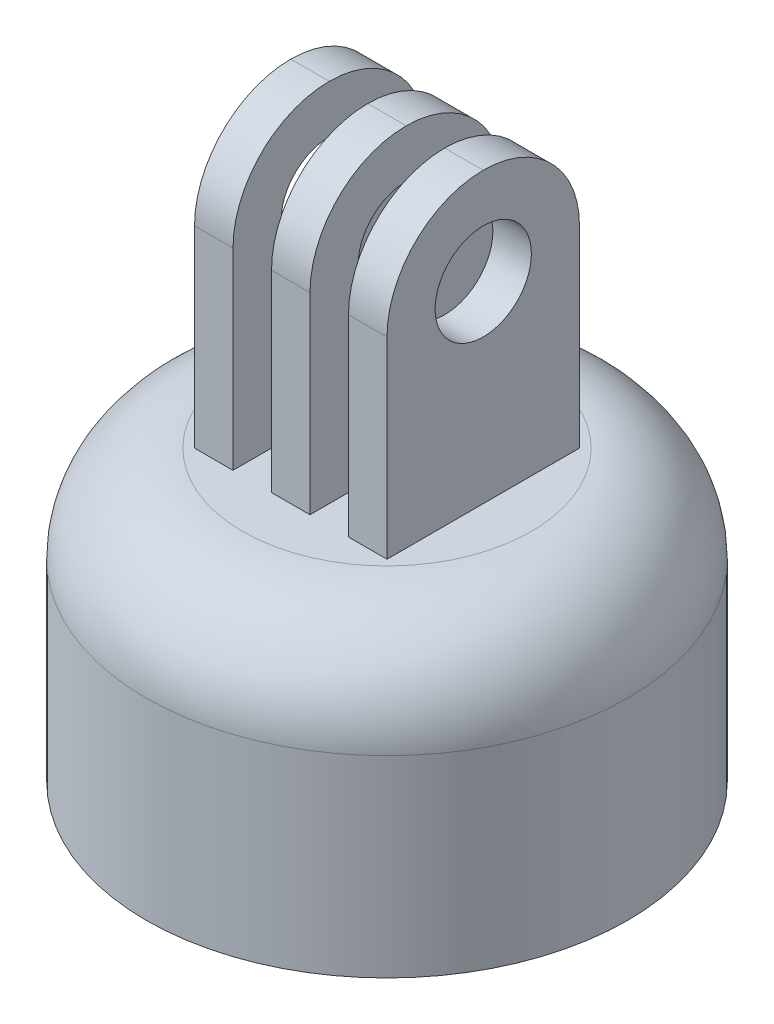
from build123d import *

# Parameters (mm, degrees)
SKETCH1_R           = 12.5
SKETCH1_R_2         = 10.5
BOSS_EXTRUDE1_DEPTH = 10
SKETCH2_R           = 12.5
BOSS_EXTRUDE2_DEPTH = 5
SKETCH3_W           = 2
SKETCH3_H           = 10
BOSS_EXTRUDE3_DEPTH = 15
FILLET1_R           = 5
FILLET2_R           = 5
SKETCH4_R           = 2.5
CUT_EXTRUDE1_DEPTH  = 15


with BuildPart() as part:
    # Sketch1 → Boss-Extrude1 (new body)
    with BuildSketch(Plane(origin=(0, 0, 0), x_dir=(1, 0, 0), z_dir=(0, 1, 0))):
        with Locations(Location((0, 0, 0), (0, 0, 270))):
            Circle(SKETCH1_R)
        with Locations(Location((0, 0, 0), (0, 0, 270))):
            Circle(SKETCH1_R_2, mode=Mode.SUBTRACT)
    extrude(amount=BOSS_EXTRUDE1_DEPTH)

    # Sketch2 → Boss-Extrude2 (add)
    with BuildSketch(Plane(origin=(0, 10, 0), x_dir=(1, 0, 0), z_dir=(0, 1, 0))):
        with Locations(Location((0, 0, 0), (0, 0, 270))):
            Circle(SKETCH2_R)
    extrude(amount=BOSS_EXTRUDE2_DEPTH)

    # Sketch3 → Boss-Extrude3 (add)
    with BuildSketch(Plane(origin=(0, 15, 0), x_dir=(1, 0, 0), z_dir=(0, 1, 0))):
        with Locations((4, 0)):
            Rectangle(SKETCH3_W, SKETCH3_H)
        Rectangle(SKETCH3_W, SKETCH3_H)
        with Locations((-4, 0)):
            Rectangle(SKETCH3_W, SKETCH3_H)
    extrude(amount=BOSS_EXTRUDE3_DEPTH)

    # Fillet1
    fillet1_edges = [part.edges().sort_by_distance(p)[0] for p in [
        (0, 15, -12.5),
    ]]
    fillet(fillet1_edges, radius=FILLET1_R)

    # Fillet2
    fillet2_edges = [part.edges().sort_by_distance(p)[0] for p in [
        (-4, 30, -5),
        (0, 30, -5),
        (4, 30, -5),
        (-4, 30, 5),
        (0, 30, 5),
        (4, 30, 5),
    ]]
    fillet(fillet2_edges, radius=FILLET2_R - 0.0001)  # a hair under: the kernel refuses the full size

    # Sketch4 → Cut-Extrude1 (cut)
    with BuildSketch(Plane(origin=(5, 0, 0), x_dir=(0, 0, -1), z_dir=(1, 0, 0))):
        with Locations((0, 25)):
            Circle(SKETCH4_R)
    extrude(amount=-CUT_EXTRUDE1_DEPTH, mode=Mode.SUBTRACT)


solid = part.part
